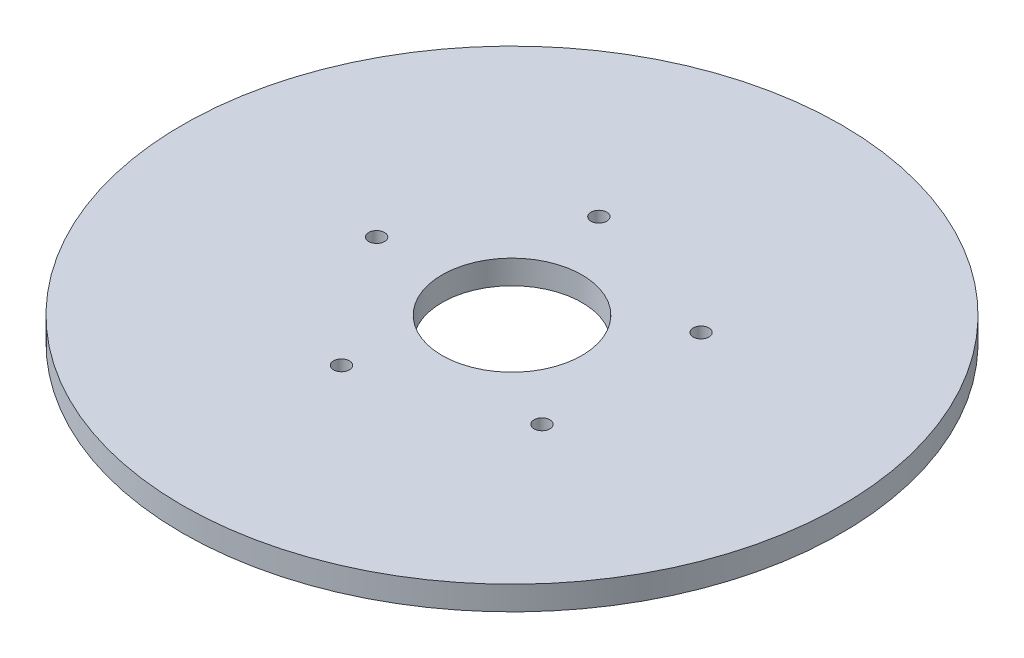
from build123d import *

# Parameters (mm, degrees)
SKETCH1_R           = 82.5
BOSS_EXTRUDE1_DEPTH = 6
SKETCH2_R           = 17.5
CUT_EXTRUDE1_DEPTH  = 117.826794872
SKETCH3_R           = 1.980266026
CUT_EXTRUDE2_DEPTH  = 3.812225106
CIRPATTERN1_COUNT   = 5


with BuildPart() as part:
    # Sketch1 → Boss-Extrude1 (new body)
    with BuildSketch(Plane(origin=(0, 0, 0), x_dir=(1, 0, 0), z_dir=(0, 1, 0))):
        Circle(SKETCH1_R)
    extrude(amount=BOSS_EXTRUDE1_DEPTH)

    # Sketch2 → Cut-Extrude1 (cut, through all)
    with BuildSketch(Plane(origin=(0, 0, 0), x_dir=(1, 0, 0), z_dir=(0, 1, 0))):
        Circle(SKETCH2_R)
    extrude(amount=CUT_EXTRUDE1_DEPTH, mode=Mode.SUBTRACT)

    # Sketch3 → Cut-Extrude2 (cut)
    with BuildSketch(Plane(origin=(0, 6, 0), x_dir=(1, 0, 0), z_dir=(0, 1, 0))):
        with Locations((-33.884434144, 0)):
            Circle(SKETCH3_R)
    cut_extrude2 = extrude(amount=-CUT_EXTRUDE2_DEPTH, mode=Mode.SUBTRACT)

    # CirPattern1: Cut-Extrude2 ×5 about axis
    cirpattern1_axis = Axis((0, 0, 0), (0, 1, 0))
    for i in range(1, CIRPATTERN1_COUNT):
        add(cut_extrude2.rotate(cirpattern1_axis, i * 360 / CIRPATTERN1_COUNT), mode=Mode.SUBTRACT)


solid = part.part
